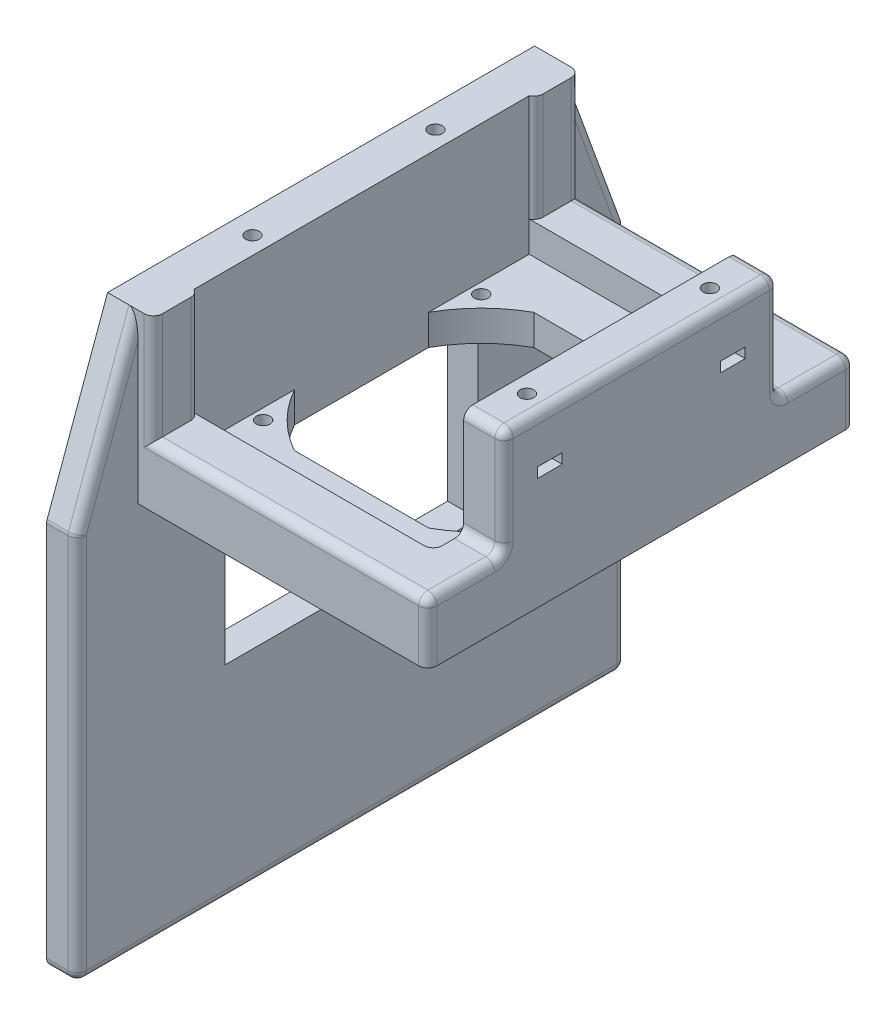
from build123d import *

# Parameters (mm, degrees)
SKETCH1_W           = 190
SKETCH1_H           = 140
BOSS_EXTRUDE1_DEPTH = 10
SKETCH3_W           = 15
SKETCH3_H           = 90
BOSS_EXTRUDE3_DEPTH = 35
SKETCH4_R           = 2.25
CUT_EXTRUDE1_DEPTH  = 20
SKETCH5_W           = 75
SKETCH5_H           = 110
CUT_EXTRUDE2_DEPTH  = 50
SKETCH8_R           = 2.5
CUT_EXTRUDE4_DEPTH  = 10
CUT_EXTRUDE5_DEPTH  = 3.3
SKETCH11_W          = 42.5
SKETCH11_H          = 140
CUT_EXTRUDE6_DEPTH  = 10
SKETCH12_W          = 15
SKETCH12_H          = 25
BOSS_EXTRUDE4_DEPTH = 35
SKETCH14_W          = 105
SKETCH14_H          = 140
BOSS_EXTRUDE5_DEPTH = 10
SKETCH15_R          = 2.25
CUT_EXTRUDE7_DEPTH  = 10
CUT_EXTRUDE8_DEPTH  = 45
SKETCH20_W          = 10
SKETCH20_H          = 180
BOSS_EXTRUDE6_DEPTH = 127
SKETCH21_W          = 83
SKETCH21_H          = 60
CUT_EXTRUDE10_DEPTH = 76.2
BOSS_EXTRUDE7_DEPTH = 10
SKETCH17_W          = 1.75
SKETCH17_H          = 10
CUT_EXTRUDE9_DEPTH  = 10
FILLET1_R           = 3


with BuildPart() as part:
    # Sketch1 → Boss-Extrude1 (new body)
    with BuildSketch(Plane(origin=(0, 0, 0), x_dir=(1, 0, 0), z_dir=(0, 1, 0))):
        with Locations((95, 70)):
            Rectangle(SKETCH1_W, SKETCH1_H)
    extrude(amount=BOSS_EXTRUDE1_DEPTH)

    # Sketch3 → Boss-Extrude3 (add)
    with BuildSketch(Plane(origin=(0, 10, 0), x_dir=(1, 0, 0), z_dir=(0, 1, 0))):
        with Locations((50, 70)):
            Rectangle(SKETCH3_W, SKETCH3_H)
        with Locations((140, 70)):
            Rectangle(SKETCH3_W, SKETCH3_H)
    extrude(amount=BOSS_EXTRUDE3_DEPTH)

    # Sketch4 → Cut-Extrude1 (cut)
    with BuildSketch(Plane(origin=(0, 45, 0), x_dir=(1, 0, 0), z_dir=(0, 1, 0))):
        with Locations(Location((50, 100, 0), (0, 0, 270))):
            Circle(SKETCH4_R)
        with Locations(Location((140, 100, 0), (0, 0, 270))):
            Circle(SKETCH4_R)
        with Locations(Location((140, 40, 0), (0, 0, 270))):
            Circle(SKETCH4_R)
        with Locations(Location((50, 40, 0), (0, 0, 270))):
            Circle(SKETCH4_R)
    extrude(amount=-CUT_EXTRUDE1_DEPTH, mode=Mode.SUBTRACT)

    # Sketch5 → Cut-Extrude2 (cut)
    with BuildSketch(Plane(origin=(0, 10, 0), x_dir=(1, 0, 0), z_dir=(0, 1, 0))):
        with Locations((95, 70)):
            Rectangle(SKETCH5_W, SKETCH5_H)
    extrude(amount=-CUT_EXTRUDE2_DEPTH, mode=Mode.SUBTRACT)

    # Sketch8 → Cut-Extrude4 (cut)
    with BuildSketch(Plane(origin=(0, 10, 0), x_dir=(1, 0, 0), z_dir=(0, 1, 0))):
        with Locations(Location((10, 130, 0), (0, 0, 270))):
            Circle(SKETCH8_R)
        with Locations(Location((180, 130, 0), (0, 0, 270))):
            Circle(SKETCH8_R)
        with Locations(Location((180, 10, 0), (0, 0, 270))):
            Circle(SKETCH8_R)
        with Locations(Location((10, 10, 0), (0, 0, 270))):
            Circle(SKETCH8_R)
    extrude(amount=-CUT_EXTRUDE4_DEPTH, mode=Mode.SUBTRACT)

    # Sketch10 → Cut-Extrude5 (cut)
    with BuildSketch(Plane(origin=(0, 30, 0), x_dir=(1, 0, 0), z_dir=(0, 1, 0))):
        Polygon((45.95, 44.05), (42.5, 44.05), (42.5, 35.95), (45.95, 35.95), (54.05, 35.95), (54.05, 44.05), align=None)
        Polygon((42.5, 95.95), (45.95, 95.95), (54.05, 95.95), (54.05, 104.05), (45.95, 104.05), (42.5, 104.05), align=None)
        Polygon((147.5, 35.95), (144.05, 35.95), (135.95, 35.95), (135.95, 44.05), (144.05, 44.05), (147.5, 44.05), align=None)
        Polygon((147.5, 104.05), (147.5, 95.95), (144.05, 95.95), (135.95, 95.95), (135.95, 104.05), (144.05, 104.05), align=None)
    extrude(amount=-CUT_EXTRUDE5_DEPTH, mode=Mode.SUBTRACT)

    # Sketch11 → Cut-Extrude6 (cut)
    with BuildSketch(Plane(origin=(0, 10, 0), x_dir=(1, 0, 0), z_dir=(0, 1, 0))):
        with Locations((168.75, 70)):
            Rectangle(SKETCH11_W, SKETCH11_H)
        with Locations((21.25, 70)):
            Rectangle(SKETCH11_W, SKETCH11_H)
    extrude(amount=-CUT_EXTRUDE6_DEPTH, mode=Mode.SUBTRACT)

    # Sketch12 → Boss-Extrude4 (add)
    with BuildSketch(Plane(origin=(0, 10, 0), x_dir=(1, 0, 0), z_dir=(0, 1, 0))):
        with Locations((50, 127.5)):
            Rectangle(SKETCH12_W, SKETCH12_H)
        with Locations((50, 12.5)):
            Rectangle(SKETCH12_W, SKETCH12_H)
    extrude(amount=BOSS_EXTRUDE4_DEPTH)

    # Sketch14 → Boss-Extrude5 (add)
    with BuildSketch(Plane.XZ):
        with Locations((95, -70)):
            Rectangle(SKETCH14_W, SKETCH14_H)
    extrude(amount=BOSS_EXTRUDE5_DEPTH)

    # Sketch15 → Cut-Extrude7 (cut)
    with BuildSketch(Plane.XZ.offset(10)):
        with BuildLine():
            Line((117.009940936, -30.75), (72.990059064, -30.75))
            ThreePointArc((72.990059064, -30.75), (63.180194847, -38.180194847), (55.75, -47.990059064))
            Line((55.75, -47.990059064), (55.75, -92.009940936))
            ThreePointArc((55.75, -92.009940936), (63.180194847, -101.819805153), (72.990059064, -109.25))
            Line((72.990059064, -109.25), (117.009940936, -109.25))
            ThreePointArc((117.009940936, -109.25), (126.819805153, -101.819805153), (134.25, -92.009940936))
            Line((134.25, -92.009940936), (134.25, -47.990059064))
            ThreePointArc((134.25, -47.990059064), (126.819805153, -38.180194847), (117.009940936, -30.75))
        make_face()
        with Locations(Location((130.75, -34.25, 0), (0, 0, 270))):
            Circle(SKETCH15_R)
        with Locations(Location((59.25, -34.25, 0), (0, 0, 270))):
            Circle(SKETCH15_R)
        with Locations(Location((59.25, -105.75, 0), (0, 0, 270))):
            Circle(SKETCH15_R)
        with Locations(Location((130.75, -105.75, 0), (0, 0, 270))):
            Circle(SKETCH15_R)
    extrude(amount=-CUT_EXTRUDE7_DEPTH, mode=Mode.SUBTRACT)

    # Sketch16 → Cut-Extrude8 (cut)
    with BuildSketch(Plane(origin=(0, 45, 0), x_dir=(1, 0, 0), z_dir=(0, 1, 0))):
        Polygon((55.75, 92.009940936), (55.75, 47.990059064), (55.75, 15), (57.5, 15), (57.5, 125), (55.75, 125), align=None)
        Polygon((134.25, 25), (134.25, 47.990059064), (134.25, 92.009940936), (134.25, 115), (132.5, 115), (132.5, 25), align=None)
    extrude(amount=-CUT_EXTRUDE8_DEPTH, mode=Mode.SUBTRACT)

    # Sketch20 → Boss-Extrude6 (add)
    with BuildSketch(Plane.XZ.offset(10)):
        with Locations((47.5, -70)):
            Rectangle(SKETCH20_W, SKETCH20_H)
    extrude(amount=BOSS_EXTRUDE6_DEPTH)

    # Sketch21 → Cut-Extrude10 (cut)
    with BuildSketch(Plane(origin=(52.5, 0, 0), x_dir=(0, 0, -1), z_dir=(1, 0, 0))):
        with Locations((70, -40)):
            Rectangle(SKETCH21_W, SKETCH21_H)
    extrude(amount=-CUT_EXTRUDE10_DEPTH, mode=Mode.SUBTRACT)

    # Sketch22 → Boss-Extrude7 (add)
    with BuildSketch(Plane(origin=(52.5, 0, 0), x_dir=(0, 0, -1), z_dir=(1, 0, 0))):
        Polygon((0, 45), (-20, -10), (0, -10), align=None)
        Polygon((140, 45), (160, -10), (140, -10), align=None)
    extrude(amount=-BOSS_EXTRUDE7_DEPTH)

    # Sketch17 → Cut-Extrude9 (cut)
    with BuildSketch(Plane(origin=(0, 10, 0), x_dir=(1, 0, 0), z_dir=(0, 1, 0))):
        with Locations((133.375, 20)):
            Rectangle(SKETCH17_W, SKETCH17_H)
        with Locations((133.375, 120)):
            Rectangle(SKETCH17_W, SKETCH17_H)
    extrude(amount=-CUT_EXTRUDE9_DEPTH, mode=Mode.SUBTRACT)

    # Fillet1
    # the kernel refuses this fillet: 3 mm, written as the material it adds along each edge
    with BuildSketch(Plane(origin=(147.5, 10, -115), x_dir=(0, 0, -1), z_dir=(-1, 0, 0))) as fillet1_piece_1:
        with BuildLine():
            CenterArc((FILLET1_R, -FILLET1_R), FILLET1_R, 90, 90)
            Line((0, -FILLET1_R), (0, 0))
            Line((0, 0), (FILLET1_R, 0))
        make_face()
    extrude(amount=13.25)
    with BuildSketch(Plane(origin=(134.25, 10, -25), x_dir=(0, 1, 0), z_dir=(1, 0, 0))) as fillet1_piece_2:
        with BuildLine():
            CenterArc((FILLET1_R, FILLET1_R), FILLET1_R, 180, 90)
            Line((0, FILLET1_R), (0, 0))
            Line((0, 0), (FILLET1_R, 0))
        make_face()
    extrude(amount=13.25)
    with BuildSketch(Plane(origin=(134.25, 10, -15), x_dir=(0, 0, -1), z_dir=(0, -1, 0))) as fillet1_piece_3:
        with BuildLine():
            CenterArc((FILLET1_R, -FILLET1_R), FILLET1_R, 90, 90)
            Line((0, -FILLET1_R), (0, 0))
            Line((0, 0), (FILLET1_R, 0))
        make_face()
    extrude(amount=17.5)
    with BuildSketch(Plane(origin=(134.25, 10, -125), x_dir=(0, 0, 1), z_dir=(0, -1, 0))) as fillet1_piece_4:
        with BuildLine():
            CenterArc((FILLET1_R, FILLET1_R), FILLET1_R, 180, 90)
            Line((0, FILLET1_R), (0, 0))
            Line((0, 0), (FILLET1_R, 0))
        make_face()
    extrude(amount=17.5)
    # the kernel refuses this fillet: 3 mm, written as the material it takes off along each edge
    with BuildSketch(Plane(origin=(49.5, -10.528524933, -157), x_dir=(0, 0, -1), z_dir=(1, 0, 0))) as fillet1_2_piece_1_section:
        Polygon((0, 0), (FILLET1_R * 1.02, 0), (FILLET1_R * 1.02, FILLET1_R * 0.179698477234), (FILLET1_R * 0.958589291958, FILLET1_R * 0.348577924348), align=None)
    fillet1_2_piece_1 = extrude(amount=FILLET1_R * 1.02, mode=Mode.PRIVATE)
    fillet1_2_piece_1 = fillet1_2_piece_1 - Plane(origin=(49.5, -10.528524933, -157), x_dir=(0, -0.17350299206578987, 0.9848333421164306), z_dir=(1, 0, 0)) * Sphere(FILLET1_R, mode=Mode.PRIVATE)
    add(fillet1_2_piece_1, mode=Mode.SUBTRACT)
    with BuildSketch(Plane(origin=(49.5, -134, -157), x_dir=(0, 0, -1), z_dir=(1, 0, 0))) as fillet1_2_piece_2_section:
        Polygon((0, 0), (FILLET1_R * 1.02, 0), (FILLET1_R * 1.02, -FILLET1_R * 1.02), (0, -FILLET1_R * 1.02), align=None)
    fillet1_2_piece_2 = extrude(amount=FILLET1_R * 1.02, mode=Mode.PRIVATE)
    fillet1_2_piece_2 = fillet1_2_piece_2 - Plane(origin=(49.5, -134, -157), x_dir=(0, 0.7071067811865475, 0.7071067811865475), z_dir=(1, 0, 0)) * Sphere(FILLET1_R, mode=Mode.PRIVATE)
    add(fillet1_2_piece_2, mode=Mode.SUBTRACT)
    with BuildSketch(Plane(origin=(49.5, -10.528524933, 17), x_dir=(0, 0.34174306308670455, 0.9397934234884371), z_dir=(1, 0, 0))) as fillet1_2_piece_3_section:
        Polygon((0, 0), (FILLET1_R * 1.02, 0), (FILLET1_R * 1.02, FILLET1_R * 0.179698477234), (FILLET1_R * 0.958589291958, FILLET1_R * 0.348577924348), align=None)
    fillet1_2_piece_3 = extrude(amount=FILLET1_R * 1.02, mode=Mode.PRIVATE)
    fillet1_2_piece_3 = fillet1_2_piece_3 - Plane(origin=(49.5, -10.528524933, 17), x_dir=(0, -0.17350299206578976, -0.9848333421164306), z_dir=(1, 0, 0)) * Sphere(FILLET1_R, mode=Mode.PRIVATE)
    add(fillet1_2_piece_3, mode=Mode.SUBTRACT)
    with BuildSketch(Plane(origin=(49.5, -134, 17), x_dir=(1, 0, 0), z_dir=(0, 0, 1))) as fillet1_2_piece_4_section:
        Polygon((0, 0), (FILLET1_R * 1.02, 0), (FILLET1_R * 1.02, -FILLET1_R * 1.02), (0, -FILLET1_R * 1.02), align=None)
    fillet1_2_piece_4 = extrude(amount=FILLET1_R * 1.02, mode=Mode.PRIVATE)
    fillet1_2_piece_4 = fillet1_2_piece_4 - Plane(origin=(49.5, -134, 17), x_dir=(-0.7071067811865475, 0.7071067811865475, 0), z_dir=(0, 0, 1)) * Sphere(FILLET1_R, mode=Mode.PRIVATE)
    add(fillet1_2_piece_4, mode=Mode.SUBTRACT)
    with BuildSketch(Plane(origin=(155, 10, -140), x_dir=(0, -1, 0), z_dir=(-1, 0, 0)), Plane(origin=(57.5, 10, 0), x_dir=(0, -1, 0), z_dir=(1, 0, 0))) as fillet1_2_piece_5:
        with BuildLine():
            CenterArc((FILLET1_R, FILLET1_R), FILLET1_R, 180, 90)
            Line((0, FILLET1_R), (0, 0))
            Line((0, 0), (FILLET1_R, 0))
        make_face()
    extrude(amount=97.5, mode=Mode.SUBTRACT)
    with BuildSketch(Plane(origin=(147.5, -17.5, 0), x_dir=(-1, 0, 0), z_dir=(0, 1, 0)), Plane(origin=(147.5, -17.5, -140), x_dir=(0, 0, 1), z_dir=(0, 1, 0))) as fillet1_2_piece_6:
        with BuildLine():
            CenterArc((FILLET1_R, -FILLET1_R), FILLET1_R, 90, 90)
            Line((0, -FILLET1_R), (0, 0))
            Line((0, 0), (FILLET1_R, 0))
        make_face()
    extrude(amount=35, mode=Mode.SUBTRACT)
    with BuildSketch(Plane(origin=(57.5, 10, -140), x_dir=(-1, 0, 0), z_dir=(0, 1, 0))) as fillet1_2_piece_7:
        with BuildLine():
            CenterArc((FILLET1_R, FILLET1_R), FILLET1_R, 180, 90)
            Line((0, FILLET1_R), (0, 0))
            Line((0, 0), (FILLET1_R, 0))
        make_face()
    extrude(amount=42.5, mode=Mode.SUBTRACT)
    with BuildSketch(Plane(origin=(57.5, 10, 0), x_dir=(-1, 0, 0), z_dir=(0, 1, 0))) as fillet1_2_piece_8:
        with BuildLine():
            CenterArc((FILLET1_R, -FILLET1_R), FILLET1_R, 90, 90)
            Line((0, -FILLET1_R), (0, 0))
            Line((0, 0), (FILLET1_R, 0))
        make_face()
    extrude(amount=42.5, mode=Mode.SUBTRACT)
    with BuildSketch(Plane(origin=(147.5, 45, -17.5), x_dir=(0, -1, 0), z_dir=(0, 0, -1))) as fillet1_2_piece_9:
        with BuildLine():
            CenterArc((FILLET1_R, FILLET1_R), FILLET1_R, 180, 90)
            Line((0, FILLET1_R), (0, 0))
            Line((0, 0), (FILLET1_R, 0))
        make_face()
    extrude(amount=105, mode=Mode.SUBTRACT)
    with BuildSketch(Plane(origin=(155, 45, -115), x_dir=(0, -1, 0), z_dir=(-1, 0, 0))) as fillet1_2_piece_10:
        with BuildLine():
            CenterArc((FILLET1_R, FILLET1_R), FILLET1_R, 180, 90)
            Line((0, FILLET1_R), (0, 0))
            Line((0, 0), (FILLET1_R, 0))
        make_face()
    extrude(amount=28.25, mode=Mode.SUBTRACT)
    with BuildSketch(Plane(origin=(126.75, 45, -25), x_dir=(0, 0, -1), z_dir=(1, 0, 0))) as fillet1_2_piece_11:
        with BuildLine():
            CenterArc((FILLET1_R, -FILLET1_R), FILLET1_R, 90, 90)
            Line((0, -FILLET1_R), (0, 0))
            Line((0, 0), (FILLET1_R, 0))
        make_face()
    extrude(amount=28.25, mode=Mode.SUBTRACT)
    with BuildSketch(Plane(origin=(49.5, -10, -160), x_dir=(0, -1, 0), z_dir=(-1, 0, 0))) as fillet1_2_piece_12:
        with BuildLine():
            CenterArc((FILLET1_R * 0.17617497768, FILLET1_R), FILLET1_R, 250.016893478, 19.983106522)
            Line((-FILLET1_R * 0.165568085407, FILLET1_R * 0.0602065765116), (0, 0))
            Line((0, 0), (FILLET1_R * 0.17617497768, 0))
        make_face()
    extrude(amount=8.321312333, mode=Mode.SUBTRACT)
    with BuildSketch(Plane(origin=(52.5, -10.528524933, -160), x_dir=(0, 0, 1), z_dir=(0, -1, 0))) as fillet1_2_piece_13:
        with BuildLine():
            CenterArc((FILLET1_R, FILLET1_R), FILLET1_R, 180, 90)
            Line((0, FILLET1_R), (0, 0))
            Line((0, 0), (FILLET1_R, 0))
        make_face()
    extrude(amount=123.471475067, mode=Mode.SUBTRACT)
    with BuildSketch(Plane(origin=(41.178687667, -10, 20), x_dir=(0, 0.9397934234884373, -0.3417430630867039), z_dir=(1, 0, 0))) as fillet1_2_piece_14:
        with BuildLine():
            CenterArc((FILLET1_R * 0.17617497768, -FILLET1_R), FILLET1_R, 90, 19.983106522)
            Line((-FILLET1_R * 0.165568085407, -FILLET1_R * 0.0602065765116), (0, 0))
            Line((0, 0), (FILLET1_R * 0.17617497768, 0))
        make_face()
    extrude(amount=8.321312333, mode=Mode.SUBTRACT)
    with BuildSketch(Plane(origin=(52.5, -10.528524933, 20), x_dir=(0, 0, -1), z_dir=(0, -1, 0))) as fillet1_2_piece_15:
        with BuildLine():
            CenterArc((FILLET1_R, -FILLET1_R), FILLET1_R, 90, 90)
            Line((0, -FILLET1_R), (0, 0))
            Line((0, 0), (FILLET1_R, 0))
        make_face()
    extrude(amount=123.471475067, mode=Mode.SUBTRACT)
    with BuildSketch(Plane(origin=(49.5, -137, -160), x_dir=(0, 0, 1), z_dir=(-1, 0, 0))) as fillet1_2_piece_16:
        with BuildLine():
            CenterArc((FILLET1_R, FILLET1_R), FILLET1_R, 180, 90)
            Line((0, FILLET1_R), (0, 0))
            Line((0, 0), (FILLET1_R, 0))
        make_face()
    extrude(amount=14.5, mode=Mode.SUBTRACT)
    with BuildSketch(Plane(origin=(52.5, -137, 17), x_dir=(0, 1, 0), z_dir=(0, 0, -1))) as fillet1_2_piece_17:
        with BuildLine():
            CenterArc((FILLET1_R, -FILLET1_R), FILLET1_R, 90, 90)
            Line((0, -FILLET1_R), (0, 0))
            Line((0, 0), (FILLET1_R, 0))
        make_face()
    extrude(amount=174, mode=Mode.SUBTRACT)
    with BuildSketch(Plane(origin=(35, -137, 20), x_dir=(0, 1, 0), z_dir=(1, 0, 0))) as fillet1_2_piece_18:
        with BuildLine():
            CenterArc((FILLET1_R, -FILLET1_R), FILLET1_R, 90, 90)
            Line((0, -FILLET1_R), (0, 0))
            Line((0, 0), (FILLET1_R, 0))
        make_face()
    extrude(amount=14.5, mode=Mode.SUBTRACT)
    with BuildSketch(Plane(origin=(52.5, 52.048450676, -2.563072973), x_dir=(0, -0.3417430630867045, -0.9397934234884371), z_dir=(0, -0.9397934234884371, 0.34174306308670455))) as fillet1_2_piece_19_section:
        with BuildLine():
            CenterArc((FILLET1_R, -FILLET1_R), FILLET1_R, 90, 90)
            Line((0, -FILLET1_R), (0, 0))
            Line((0, 0), (FILLET1_R, 0))
        make_face()
    fillet1_2_piece_19 = extrude(amount=65.494974621, mode=Mode.PRIVATE)
    fillet1_2_piece_19 = split(fillet1_2_piece_19, bisect_by=Plane(origin=(52.5, 52.048450676, 0), z_dir=(0, 0, 1)), keep=Keep.TOP, mode=Mode.PRIVATE)
    add(fillet1_2_piece_19, mode=Mode.SUBTRACT)
    with BuildSketch(Plane(origin=(52.5, 52.048450676, -137.436927027), x_dir=(0, -0.34174306308670477, 0.9397934234884369), z_dir=(0, -0.9397934234884369, -0.34174306308670477))) as fillet1_2_piece_20_section:
        with BuildLine():
            CenterArc((FILLET1_R, FILLET1_R), FILLET1_R, 180, 90)
            Line((0, FILLET1_R), (0, 0))
            Line((0, 0), (FILLET1_R, 0))
        make_face()
    fillet1_2_piece_20 = extrude(amount=65.494974621, mode=Mode.PRIVATE)
    fillet1_2_piece_20 = split(fillet1_2_piece_20, bisect_by=Plane(origin=(52.5, 52.048450676, -140), z_dir=(0, 0, -1)), keep=Keep.TOP, mode=Mode.PRIVATE)
    add(fillet1_2_piece_20, mode=Mode.SUBTRACT)
    with BuildSketch(Plane(origin=(57.5, 51.817945072, -15), x_dir=(0, 0, 1), z_dir=(0, -1, 0))) as fillet1_2_piece_21:
        with BuildLine():
            CenterArc((2.727178029, 3), FILLET1_R, 204.624318352, 65.375681648)
            Line((0, 1.75), (0, 0))
            Line((0, 0), (2.727178029, 0))
        make_face()
    extrude(amount=41.817945072, mode=Mode.SUBTRACT)
    with BuildSketch(Plane(origin=(57.5, 51.817945072, -125), x_dir=(-1, 0, 0), z_dir=(0, -1, 0))) as fillet1_2_piece_22:
        with BuildLine():
            CenterArc((3, 2.727178029), FILLET1_R, 180, 65.375681648)
            Line((0, 2.727178029), (0, 0))
            Line((0, 0), (1.75, 0))
        make_face()
    extrude(amount=41.817945072, mode=Mode.SUBTRACT)
    with BuildSketch(Plane(origin=(57.5, 2.5, -140), x_dir=(-1, 0, 0), z_dir=(0, 1, 0))) as fillet1_2_piece_23a_section:
        with BuildLine():
            CenterArc((FILLET1_R, FILLET1_R), FILLET1_R, 180, 90)
            Line((0, FILLET1_R), (0, 0))
            Line((0, 0), (FILLET1_R, 0))
        make_face()
    fillet1_2_piece_23a = extrude(amount=42.5, mode=Mode.PRIVATE)
    fillet1_2_piece_23a = split(fillet1_2_piece_23a, bisect_by=Plane(origin=(57.5, 10, -140), z_dir=(0, -1, 0)), keep=Keep.TOP, mode=Mode.PRIVATE)
    with BuildSketch(Plane(origin=(147.5, 10, -140), x_dir=(0, -1, 0), z_dir=(-1, 0, 0))) as fillet1_2_piece_23b_section:
        with BuildLine():
            CenterArc((FILLET1_R, FILLET1_R), FILLET1_R, 180, 90)
            Line((0, FILLET1_R), (0, 0))
            Line((0, 0), (FILLET1_R, 0))
        make_face()
    fillet1_2_piece_23b = extrude(amount=97.5, mode=Mode.PRIVATE)
    fillet1_2_piece_23b = split(fillet1_2_piece_23b, bisect_by=Plane(origin=(52.5, 10, -140), z_dir=(1, 0, 0)), keep=Keep.TOP, mode=Mode.PRIVATE)
    fillet1_2_piece_23b = split(fillet1_2_piece_23b, bisect_by=Plane(origin=(57.5, 10, -140), z_dir=(-1, 0, 0)), keep=Keep.TOP, mode=Mode.PRIVATE)
    fillet1_2_piece_23 = fillet1_2_piece_23a & fillet1_2_piece_23b
    add(fillet1_2_piece_23, mode=Mode.SUBTRACT)
    with BuildSketch(Plane(origin=(50, 10, 0), x_dir=(0, -1, 0), z_dir=(1, 0, 0))) as fillet1_2_piece_24a_section:
        with BuildLine():
            CenterArc((FILLET1_R, FILLET1_R), FILLET1_R, 180, 90)
            Line((0, FILLET1_R), (0, 0))
            Line((0, 0), (FILLET1_R, 0))
        make_face()
    fillet1_2_piece_24a = extrude(amount=97.5, mode=Mode.PRIVATE)
    fillet1_2_piece_24a = split(fillet1_2_piece_24a, bisect_by=Plane(origin=(52.5, 10, 0), z_dir=(1, 0, 0)), keep=Keep.TOP, mode=Mode.PRIVATE)
    fillet1_2_piece_24a = split(fillet1_2_piece_24a, bisect_by=Plane(origin=(57.5, 10, 0), z_dir=(-1, 0, 0)), keep=Keep.TOP, mode=Mode.PRIVATE)
    with BuildSketch(Plane(origin=(57.5, 2.5, 0), x_dir=(-1, 0, 0), z_dir=(0, 1, 0))) as fillet1_2_piece_24b_section:
        with BuildLine():
            CenterArc((FILLET1_R, -FILLET1_R), FILLET1_R, 90, 90)
            Line((0, -FILLET1_R), (0, 0))
            Line((0, 0), (FILLET1_R, 0))
        make_face()
    fillet1_2_piece_24b = extrude(amount=42.5, mode=Mode.PRIVATE)
    fillet1_2_piece_24b = split(fillet1_2_piece_24b, bisect_by=Plane(origin=(57.5, 10, 0), z_dir=(0, -1, 0)), keep=Keep.TOP, mode=Mode.PRIVATE)
    fillet1_2_piece_24 = fillet1_2_piece_24a & fillet1_2_piece_24b
    add(fillet1_2_piece_24, mode=Mode.SUBTRACT)
    # the kernel refuses this fillet: 3 mm, written as the material it takes off along each edge
    with BuildSketch(Plane(origin=(144.5, 42, -112), x_dir=(0, 0, -1), z_dir=(1, 0, 0))) as fillet1_3_piece_1_section:
        Polygon((0, 0), (FILLET1_R * 1.02, 0), (FILLET1_R * 1.02, FILLET1_R * 1.02), (0, FILLET1_R * 1.02), align=None)
    fillet1_3_piece_1 = extrude(amount=FILLET1_R * 1.02, mode=Mode.PRIVATE)
    fillet1_3_piece_1 = fillet1_3_piece_1 - Plane(origin=(144.5, 42, -112), x_dir=(0, -0.7071067811865475, 0.7071067811865475), z_dir=(1, 0, 0)) * Sphere(FILLET1_R, mode=Mode.PRIVATE)
    add(fillet1_3_piece_1, mode=Mode.SUBTRACT)
    with BuildSketch(Plane(origin=(144.5, 42, -28), x_dir=(0, 0, 1), z_dir=(1, 0, 0))) as fillet1_3_piece_2_section:
        Polygon((0, 0), (FILLET1_R * 1.02, 0), (FILLET1_R * 1.02, -FILLET1_R * 1.02), (0, -FILLET1_R * 1.02), align=None)
    fillet1_3_piece_2 = extrude(amount=FILLET1_R * 1.02, mode=Mode.PRIVATE)
    fillet1_3_piece_2 = fillet1_3_piece_2 - Plane(origin=(144.5, 42, -28), x_dir=(0, -0.7071067811865475, -0.7071067811865475), z_dir=(1, 0, 0)) * Sphere(FILLET1_R, mode=Mode.PRIVATE)
    add(fillet1_3_piece_2, mode=Mode.SUBTRACT)
    with BuildSketch(Plane(origin=(144.5, 7, -3), x_dir=(0, 1, 0), z_dir=(1, 0, 0))) as fillet1_3_piece_3_section:
        Polygon((0, 0), (FILLET1_R * 1.02, 0), (FILLET1_R * 1.02, FILLET1_R * 1.02), (0, FILLET1_R * 1.02), align=None)
    fillet1_3_piece_3 = extrude(amount=FILLET1_R * 1.02, mode=Mode.PRIVATE)
    fillet1_3_piece_3 = fillet1_3_piece_3 - Plane(origin=(144.5, 7, -3), x_dir=(0, -0.7071067811865475, -0.7071067811865475), z_dir=(1, 0, 0)) * Sphere(FILLET1_R, mode=Mode.PRIVATE)
    add(fillet1_3_piece_3, mode=Mode.SUBTRACT)
    with BuildSketch(Plane(origin=(144.5, 7, -137), x_dir=(0, 1, 0), z_dir=(1, 0, 0))) as fillet1_3_piece_4_section:
        Polygon((0, 0), (FILLET1_R * 1.02, 0), (FILLET1_R * 1.02, -FILLET1_R * 1.02), (0, -FILLET1_R * 1.02), align=None)
    fillet1_3_piece_4 = extrude(amount=FILLET1_R * 1.02, mode=Mode.PRIVATE)
    fillet1_3_piece_4 = fillet1_3_piece_4 - Plane(origin=(144.5, 7, -137), x_dir=(0, -0.7071067811865475, 0.7071067811865475), z_dir=(1, 0, 0)) * Sphere(FILLET1_R, mode=Mode.PRIVATE)
    add(fillet1_3_piece_4, mode=Mode.SUBTRACT)
    with BuildSketch(Plane(origin=(147.5, 10, -118), x_dir=(0, -1, 0), z_dir=(0, 0, -1)), Plane(origin=(147.5, 10, -3), x_dir=(0, -1, 0), z_dir=(0, 0, -1))) as fillet1_3_piece_5:
        with BuildLine():
            CenterArc((FILLET1_R, FILLET1_R), FILLET1_R, 180, 90)
            Line((0, FILLET1_R), (0, 0))
            Line((0, 0), (FILLET1_R, 0))
        make_face()
    extrude(amount=19, mode=Mode.SUBTRACT)
    with BuildSketch(Plane(origin=(147.5, 13, -25), x_dir=(0, 0, -1), z_dir=(0, 1, 0))) as fillet1_3_piece_6:
        with BuildLine():
            CenterArc((FILLET1_R, FILLET1_R), FILLET1_R, 180, 90)
            Line((0, FILLET1_R), (0, 0))
            Line((0, 0), (FILLET1_R, 0))
        make_face()
    extrude(amount=29, mode=Mode.SUBTRACT)
    with BuildSketch(Plane(origin=(147.5, 13, -115), x_dir=(0, 0, 1), z_dir=(0, 1, 0))) as fillet1_3_piece_7:
        with BuildLine():
            CenterArc((FILLET1_R, -FILLET1_R), FILLET1_R, 90, 90)
            Line((0, -FILLET1_R), (0, 0))
            Line((0, 0), (FILLET1_R, 0))
        make_face()
    extrude(amount=29, mode=Mode.SUBTRACT)
    with BuildSketch(Plane(origin=(147.5, 13, -118), x_dir=(0, -1, 0), z_dir=(0, 0, -1))) as fillet1_3_piece_8:
        with BuildLine():
            CenterArc((3 + FILLET1_R, FILLET1_R), FILLET1_R, 180, 90)
            Line((3, FILLET1_R), (3, 0))
            Line((3, 0), (3 + FILLET1_R, 0))
        make_face()
    revolve(axis=Axis((147.5, 13, -118), (-1, 0, 0)), revolution_arc=90, mode=Mode.SUBTRACT)
    with BuildSketch(Plane(origin=(147.5, 13, -22), x_dir=(0, 0, -1), z_dir=(0, 1, 0))) as fillet1_3_piece_9:
        with BuildLine():
            CenterArc((3 + FILLET1_R, FILLET1_R), FILLET1_R, 180, 90)
            Line((3, FILLET1_R), (3, 0))
            Line((3, 0), (3 + FILLET1_R, 0))
        make_face()
    revolve(axis=Axis((147.5, 13, -22), (-1, 0, 0)), revolution_arc=90, mode=Mode.SUBTRACT)


solid = part.part
